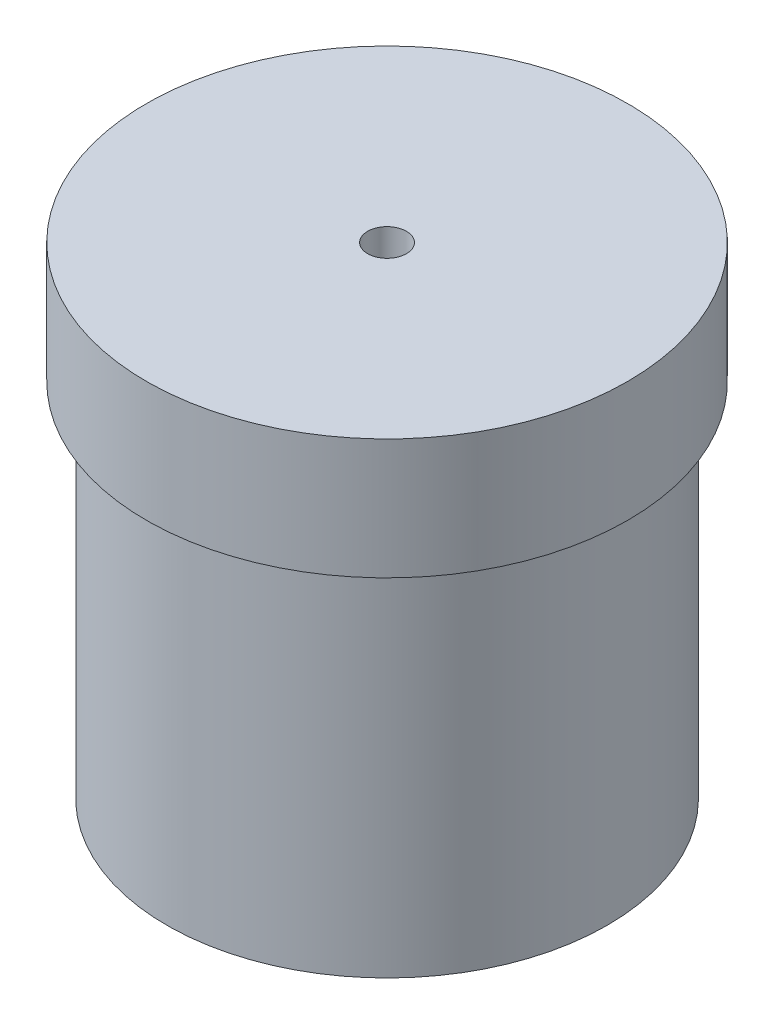
from build123d import *

# Parameters (mm, degrees)
M2_5X0_45_TAPPED_HOLE1_D     = 2.05
M2_5X0_45_TAPPED_HOLE1_DEPTH = 6.35
M2_5X0_45_TAPPED_HOLE1_TIP   = 0.615882135


with BuildPart() as part:
    # Sketch1 → Revolve1 (revolve)
    with BuildSketch(Plane.XY):
        Polygon((0, 12.7), (-12.7, 12.7), (-12.7, 6.35), (-11.6205, 6.35), (-11.6205, -12.7), (0, -12.7), align=None)
    revolve(axis=Axis((0, -12.7, 0), (0, 1, 0)))

    # M2.5x0.45 Tapped Hole1
    with Locations(Plane(origin=(0, 12.7, 0), x_dir=(1, 0, 0), z_dir=(0, 1, 0))):
        with Locations((0, 0)):
            Hole(M2_5X0_45_TAPPED_HOLE1_D / 2, depth=M2_5X0_45_TAPPED_HOLE1_DEPTH)
            with Locations((0, 0, -(M2_5X0_45_TAPPED_HOLE1_DEPTH + M2_5X0_45_TAPPED_HOLE1_TIP / 2))):  # 118° drill point
                Cone(0, M2_5X0_45_TAPPED_HOLE1_D / 2, M2_5X0_45_TAPPED_HOLE1_TIP, mode=Mode.SUBTRACT)


solid = part.part
